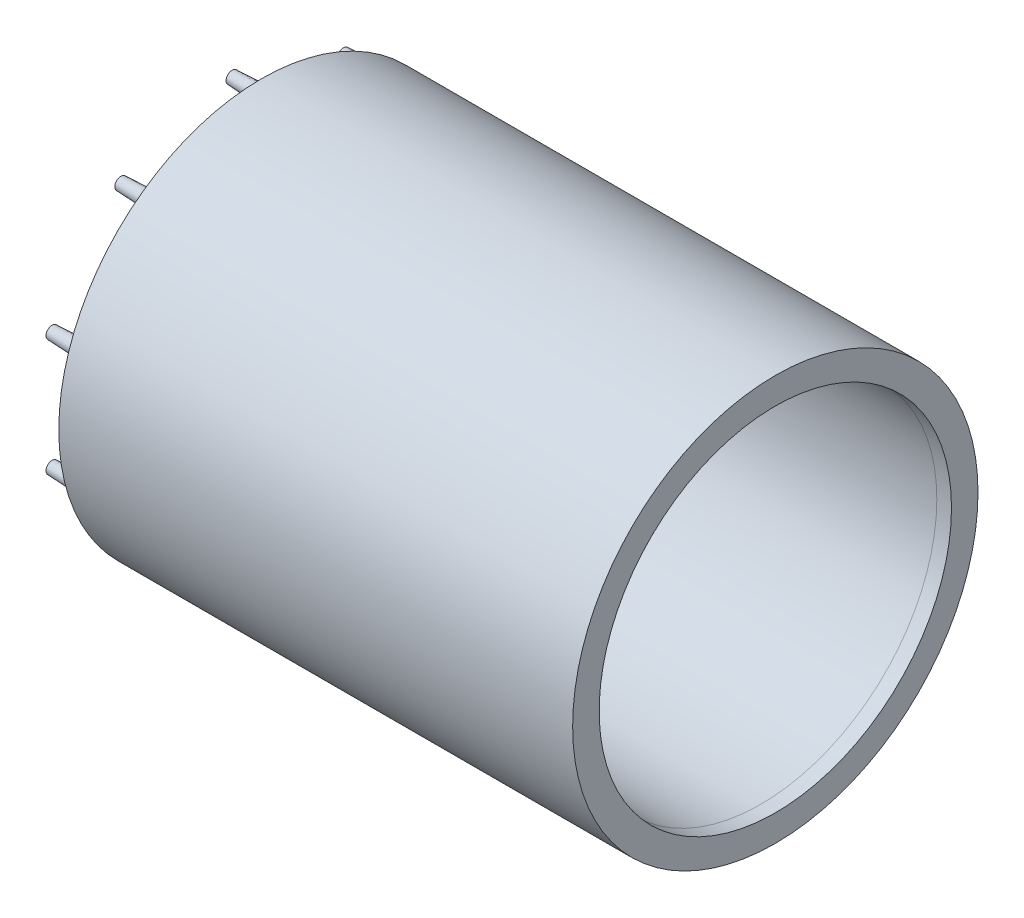
from build123d import *

# Parameters (mm, degrees)
SKETCH2_R                      = 110.114743718
CUT_EXTRUDE1_DEPTH             = 737.012183471
SKETCH3_R                      = 3.175
BOSS_EXTRUDE1_DEPTH            = 12.7
BOSS_EXTRUDE1_DRAFT            = 2.5
BOSS_EXTRUDE1_PROFILE_2_DEPTH  = 12.7
BOSS_EXTRUDE1_PROFILE_2_DRAFT  = 2.5
BOSS_EXTRUDE1_PROFILE_3_DEPTH  = 12.7
BOSS_EXTRUDE1_PROFILE_3_DRAFT  = 2.5
BOSS_EXTRUDE1_PROFILE_4_DEPTH  = 12.7
BOSS_EXTRUDE1_PROFILE_4_DRAFT  = 2.5
BOSS_EXTRUDE1_PROFILE_5_DEPTH  = 12.7
BOSS_EXTRUDE1_PROFILE_5_DRAFT  = 2.5
BOSS_EXTRUDE1_PROFILE_6_DEPTH  = 12.7
BOSS_EXTRUDE1_PROFILE_6_DRAFT  = 2.5
BOSS_EXTRUDE1_PROFILE_7_DEPTH  = 12.7
BOSS_EXTRUDE1_PROFILE_7_DRAFT  = 2.5
BOSS_EXTRUDE1_PROFILE_8_DEPTH  = 12.7
BOSS_EXTRUDE1_PROFILE_8_DRAFT  = 2.5
BOSS_EXTRUDE1_PROFILE_9_DEPTH  = 12.7
BOSS_EXTRUDE1_PROFILE_9_DRAFT  = 2.5
BOSS_EXTRUDE1_PROFILE_10_DEPTH = 12.7
BOSS_EXTRUDE1_PROFILE_10_DRAFT = 2.5


with BuildPart() as part:
    # Sketch1 → Revolve1 (revolve)
    with BuildSketch(Plane.XY):
        with BuildLine():
            Line((6.35, 11.460570284), (-259.812483715, 11.460570284))
            add(Edge.make_bspline(
                [(-259.812483715, 11.460570284), (-287.31210638, 10.562340852), (-342.298022137, 8.171569009), (-452.140135716, 1.833524736), (-589.280273052, -8.512118808), (-726.176632388, -21.770900754), (-835.465785428, -34.58872614), (-890.027026607, -41.965202762), (-917.245364413, -46.039623622)],
                knots=[0.121539178, 0.121539178, 0.121539178, 0.121539178, 0.200323508, 0.279107838, 0.436676499, 0.594245159, 0.67302949, 0.75181382, 0.75181382, 0.75181382, 0.75181382], degree=3))
            ThreePointArc((-917.245364413, -46.039623622), (-924.987260279, -50.310773033), (-928.0652, -58.599678629))
            Line((-928.0652, -58.599678629), (-921.7152, -58.599678629))
            ThreePointArc((-921.7152, -58.599678629), (-920.17623014, -54.455225831), (-916.305282206, -52.319651125))
            add(Edge.make_bspline(
                [(-259.605182082, 5.113954963), (-267.127682546, 4.868244998), (-283.42603151, 4.285669281), (-317.270262329, 2.880505646), (-361.130016616, 0.711244662), (-431.275457269, -3.371956494), (-501.372917975, -8.266876273), (-571.414486843, -13.891682648), (-623.914744737, -18.477698889), (-676.380314027, -23.439349795), (-728.80566324, -28.799062072), (-772.453634614, -33.627485173), (-807.34181653, -37.739154543), (-833.490683911, -40.958900147), (-859.619375692, -44.328941115), (-885.723877265, -47.869335132), (-904.612492975, -50.577906922), (-914.800968172, -52.094464395), (-916.305282206, -52.319651125)],
                knots=[0.121539178, 0.121539178, 0.121539178, 0.121539178, 0.143122913, 0.168303261, 0.218663957, 0.269024652, 0.369746043, 0.420106738, 0.470467434, 0.520828129, 0.571188825, 0.62154952, 0.646729868, 0.671910216, 0.697090564, 0.722270911, 0.747451259, 0.75181382, 0.75181382, 0.75181382, 0.75181382], degree=3))
            ThreePointArc((-259.605182082, 5.113954963), (-256.399753184, 4.364993874), (-254, 2.11179575))
            ThreePointArc((-254, 2.11179575), (-251.60858665, -0.136927523), (-248.413737762, -0.890953221))
            add(Edge.make_bspline(
                [(0, 0), (-50.8, 0), (-101.6, 0), (-157.182375328, 0), (-166.747125983, 0), (-181.094251966, 0), (-190.659002621, 0), (-199.585120865, 0), (-207.872606698, 0), (-220.304800851, -0.154959839), (-228.589711976, -0.361524821), (-235.094659099, -0.523710542), (-239.819642219, -0.641517002), (-245.046645359, -0.791480258), (-247.911294959, -0.876040976), (-248.413737762, -0.890953221)],
                knots=[0.761574077, 0.761574077, 0.761574077, 0.761574077, 0.907841521, 0.907841521, 0.921611321, 0.935381121, 0.94915092, 0.94915092, 0.961081918, 0.973012916, 0.984943914, 0.984943914, 0.991748303, 0.998552693, 1, 1, 1, 1], degree=3))
            Line((0, 0), (6.35, 0))
            Line((6.35, 0), (6.35, 11.460570284))
        make_face()
    revolve(axis=Axis((0, -76.2, 0), (-1, 0, 0)))

    # Sketch2 → Cut-Extrude1 (cut, through all)
    with BuildSketch(Plane(origin=(-215.9, 0, 0), x_dir=(0, 0, -1), z_dir=(1, 0, 0))):
        with Locations((0, -76.2)):
            Circle(SKETCH2_R)
    extrude(amount=-CUT_EXTRUDE1_DEPTH, mode=Mode.SUBTRACT)


with BuildPart() as boss_extrude1_tool:
    # Sketch3 → Boss-Extrude1 (with draft: the straight prism first)
    with BuildSketch(Plane.ZY.offset(215.9)):
        with Locations((0, 5.676206313)):
            Circle(SKETCH3_R)
    extrude(amount=BOSS_EXTRUDE1_DEPTH)
    # Boss-Extrude1: the draft: its side faces are tilted about the plane it starts from
    boss_extrude1_sides = [boss_extrude1_tool.faces().sort_by_distance(p)[0] for p in [
        (-222.25, 5.676206313, -3.175),
    ]]
    draft(boss_extrude1_sides, Plane.ZY.offset(215.9), BOSS_EXTRUDE1_DRAFT)


with BuildPart() as part_1:
    add(part.part)

    # Boss-Extrude1: add boss_extrude1_tool
    add(boss_extrude1_tool.part)


with BuildPart() as boss_extrude1_profile_2_tool:
    # Sketch3 → Boss-Extrude1 profile 2 (with draft: the straight prism first)
    with BuildSketch(Plane.ZY.offset(215.9)):
        with Locations((48.125626585, -9.960757658)):
            Circle(SKETCH3_R)
    extrude(amount=BOSS_EXTRUDE1_PROFILE_2_DEPTH)
    # Boss-Extrude1 profile 2: the draft: its side faces are tilted about the plane it starts from
    boss_extrude1_profile_2_sides = [boss_extrude1_profile_2_tool.faces().sort_by_distance(p)[0] for p in [
        (-222.25, -9.960757658, 44.950626585),
    ]]
    draft(boss_extrude1_profile_2_sides, Plane.ZY.offset(215.9), BOSS_EXTRUDE1_PROFILE_2_DRAFT)


with BuildPart() as part_2:
    add(part_1.part)

    # Boss-Extrude1 profile 2: add boss_extrude1_profile_2_tool
    add(boss_extrude1_profile_2_tool.part)


with BuildPart() as boss_extrude1_profile_3_tool:
    # Sketch3 → Boss-Extrude1 profile 3 (with draft: the straight prism first)
    with BuildSketch(Plane.ZY.offset(215.9)):
        with Locations((77.868899544, -50.898860814)):
            Circle(SKETCH3_R)
    extrude(amount=BOSS_EXTRUDE1_PROFILE_3_DEPTH)
    # Boss-Extrude1 profile 3: the draft: its side faces are tilted about the plane it starts from
    boss_extrude1_profile_3_sides = [boss_extrude1_profile_3_tool.faces().sort_by_distance(p)[0] for p in [
        (-222.25, -50.898860814, 74.693899544),
    ]]
    draft(boss_extrude1_profile_3_sides, Plane.ZY.offset(215.9), BOSS_EXTRUDE1_PROFILE_3_DRAFT)


with BuildPart() as part_3:
    add(part_2.part)

    # Boss-Extrude1 profile 3: add boss_extrude1_profile_3_tool
    add(boss_extrude1_profile_3_tool.part)


with BuildPart() as boss_extrude1_profile_4_tool:
    # Sketch3 → Boss-Extrude1 profile 4 (with draft: the straight prism first)
    with BuildSketch(Plane.ZY.offset(215.9)):
        with Locations((77.868899544, -101.501139186)):
            Circle(SKETCH3_R)
    extrude(amount=BOSS_EXTRUDE1_PROFILE_4_DEPTH)
    # Boss-Extrude1 profile 4: the draft: its side faces are tilted about the plane it starts from
    boss_extrude1_profile_4_sides = [boss_extrude1_profile_4_tool.faces().sort_by_distance(p)[0] for p in [
        (-222.25, -101.501139186, 74.693899544),
    ]]
    draft(boss_extrude1_profile_4_sides, Plane.ZY.offset(215.9), BOSS_EXTRUDE1_PROFILE_4_DRAFT)


with BuildPart() as part_4:
    add(part_3.part)

    # Boss-Extrude1 profile 4: add boss_extrude1_profile_4_tool
    add(boss_extrude1_profile_4_tool.part)


with BuildPart() as boss_extrude1_profile_5_tool:
    # Sketch3 → Boss-Extrude1 profile 5 (with draft: the straight prism first)
    with BuildSketch(Plane.ZY.offset(215.9)):
        with Locations((48.125626585, -142.439242342)):
            Circle(SKETCH3_R)
    extrude(amount=BOSS_EXTRUDE1_PROFILE_5_DEPTH)
    # Boss-Extrude1 profile 5: the draft: its side faces are tilted about the plane it starts from
    boss_extrude1_profile_5_sides = [boss_extrude1_profile_5_tool.faces().sort_by_distance(p)[0] for p in [
        (-222.25, -142.439242342, 44.950626585),
    ]]
    draft(boss_extrude1_profile_5_sides, Plane.ZY.offset(215.9), BOSS_EXTRUDE1_PROFILE_5_DRAFT)


with BuildPart() as part_5:
    add(part_4.part)

    # Boss-Extrude1 profile 5: add boss_extrude1_profile_5_tool
    add(boss_extrude1_profile_5_tool.part)


with BuildPart() as boss_extrude1_profile_6_tool:
    # Sketch3 → Boss-Extrude1 profile 6 (with draft: the straight prism first)
    with BuildSketch(Plane.ZY.offset(215.9)):
        with Locations((0, -158.076206313)):
            Circle(SKETCH3_R)
    extrude(amount=BOSS_EXTRUDE1_PROFILE_6_DEPTH)
    # Boss-Extrude1 profile 6: the draft: its side faces are tilted about the plane it starts from
    boss_extrude1_profile_6_sides = [boss_extrude1_profile_6_tool.faces().sort_by_distance(p)[0] for p in [
        (-222.25, -158.076206313, -3.175),
    ]]
    draft(boss_extrude1_profile_6_sides, Plane.ZY.offset(215.9), BOSS_EXTRUDE1_PROFILE_6_DRAFT)


with BuildPart() as part_6:
    add(part_5.part)

    # Boss-Extrude1 profile 6: add boss_extrude1_profile_6_tool
    add(boss_extrude1_profile_6_tool.part)


with BuildPart() as boss_extrude1_profile_7_tool:
    # Sketch3 → Boss-Extrude1 profile 7 (with draft: the straight prism first)
    with BuildSketch(Plane.ZY.offset(215.9)):
        with Locations((-48.125626585, -142.439242342)):
            Circle(SKETCH3_R)
    extrude(amount=BOSS_EXTRUDE1_PROFILE_7_DEPTH)
    # Boss-Extrude1 profile 7: the draft: its side faces are tilted about the plane it starts from
    boss_extrude1_profile_7_sides = [boss_extrude1_profile_7_tool.faces().sort_by_distance(p)[0] for p in [
        (-222.25, -142.439242342, -51.300626585),
    ]]
    draft(boss_extrude1_profile_7_sides, Plane.ZY.offset(215.9), BOSS_EXTRUDE1_PROFILE_7_DRAFT)


with BuildPart() as part_7:
    add(part_6.part)

    # Boss-Extrude1 profile 7: add boss_extrude1_profile_7_tool
    add(boss_extrude1_profile_7_tool.part)


with BuildPart() as boss_extrude1_profile_8_tool:
    # Sketch3 → Boss-Extrude1 profile 8 (with draft: the straight prism first)
    with BuildSketch(Plane.ZY.offset(215.9)):
        with Locations((-77.868899544, -101.501139186)):
            Circle(SKETCH3_R)
    extrude(amount=BOSS_EXTRUDE1_PROFILE_8_DEPTH)
    # Boss-Extrude1 profile 8: the draft: its side faces are tilted about the plane it starts from
    boss_extrude1_profile_8_sides = [boss_extrude1_profile_8_tool.faces().sort_by_distance(p)[0] for p in [
        (-222.25, -101.501139186, -81.043899544),
    ]]
    draft(boss_extrude1_profile_8_sides, Plane.ZY.offset(215.9), BOSS_EXTRUDE1_PROFILE_8_DRAFT)


with BuildPart() as part_8:
    add(part_7.part)

    # Boss-Extrude1 profile 8: add boss_extrude1_profile_8_tool
    add(boss_extrude1_profile_8_tool.part)


with BuildPart() as boss_extrude1_profile_9_tool:
    # Sketch3 → Boss-Extrude1 profile 9 (with draft: the straight prism first)
    with BuildSketch(Plane.ZY.offset(215.9)):
        with Locations((-77.868899544, -50.898860814)):
            Circle(SKETCH3_R)
    extrude(amount=BOSS_EXTRUDE1_PROFILE_9_DEPTH)
    # Boss-Extrude1 profile 9: the draft: its side faces are tilted about the plane it starts from
    boss_extrude1_profile_9_sides = [boss_extrude1_profile_9_tool.faces().sort_by_distance(p)[0] for p in [
        (-222.25, -50.898860814, -81.043899544),
    ]]
    draft(boss_extrude1_profile_9_sides, Plane.ZY.offset(215.9), BOSS_EXTRUDE1_PROFILE_9_DRAFT)


with BuildPart() as part_9:
    add(part_8.part)

    # Boss-Extrude1 profile 9: add boss_extrude1_profile_9_tool
    add(boss_extrude1_profile_9_tool.part)


with BuildPart() as boss_extrude1_profile_10_tool:
    # Sketch3 → Boss-Extrude1 profile 10 (with draft: the straight prism first)
    with BuildSketch(Plane.ZY.offset(215.9)):
        with Locations((-48.125626585, -9.960757658)):
            Circle(SKETCH3_R)
    extrude(amount=BOSS_EXTRUDE1_PROFILE_10_DEPTH)
    # Boss-Extrude1 profile 10: the draft: its side faces are tilted about the plane it starts from
    boss_extrude1_profile_10_sides = [boss_extrude1_profile_10_tool.faces().sort_by_distance(p)[0] for p in [
        (-222.25, -9.960757658, -51.300626585),
    ]]
    draft(boss_extrude1_profile_10_sides, Plane.ZY.offset(215.9), BOSS_EXTRUDE1_PROFILE_10_DRAFT)


with BuildPart() as part_10:
    add(part_9.part)

    # Boss-Extrude1 profile 10: add boss_extrude1_profile_10_tool
    add(boss_extrude1_profile_10_tool.part)


solid = part_10.part
